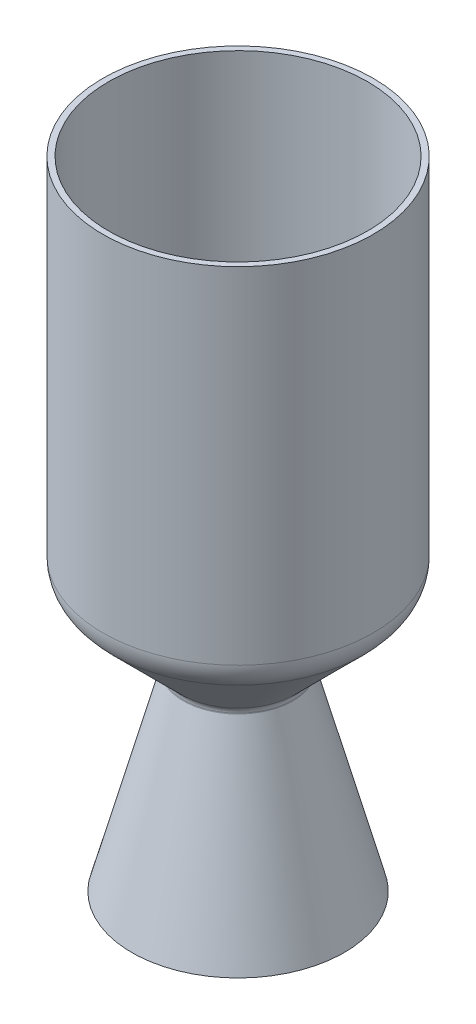
from build123d import *


with BuildPart() as part:
    # Sketch1 → Revolve-Thin1 (revolve)
    with BuildSketch(Plane.XY, mode=Mode.PRIVATE) as revolve_thin1_sk:
        with BuildLine():
            Line((-57.15, 195.850768363), (-57.15, 43.450768363))
            ThreePointArc((-57.15, 43.450768363), (-56.183270063, 38.590688772), (-53.430256121, 34.470512242))
            Line((-53.430256121, 34.470512242), (-23.449871939, 4.490128061))
            ThreePointArc((-23.449871939, 4.490128061), (-22.073364969, 2.430039796), (-21.59, 0))
            ThreePointArc((-21.59, 0), (-21.622595078, -0.497304792), (-21.719822602, -0.986100562))
            Line((-21.719822602, -0.986100562), (-44.45, -85.816277477))
            Line((-44.45, -85.816277477), (-46.903451599, -85.158877102))
            Line((-46.903451599, -85.158877102), (-24.173274201, -0.328700187))
            ThreePointArc((-24.173274201, -0.328700187), (-24.140865026, -0.165768264), (-24.13, 0))
            ThreePointArc((-24.13, 0), (-24.420018981, 1.458023877), (-25.245923164, 2.694076836))
            Line((-25.245923164, 2.694076836), (-55.226307345, 32.674461018))
            ThreePointArc((-55.226307345, 32.674461018), (-58.529924075, 37.618672854), (-59.69, 43.450768363))
            Line((-59.69, 43.450768363), (-59.69, 195.850768363))
            Line((-59.69, 195.850768363), (-57.15, 195.850768363))
        make_face()
    revolve(revolve_thin1_sk.sketch.rotate(Axis((0, 0, 0), (0, 1, 0)), 270), axis=Axis((0, 0, 0), (0, 1, 0)))


solid = part.part
